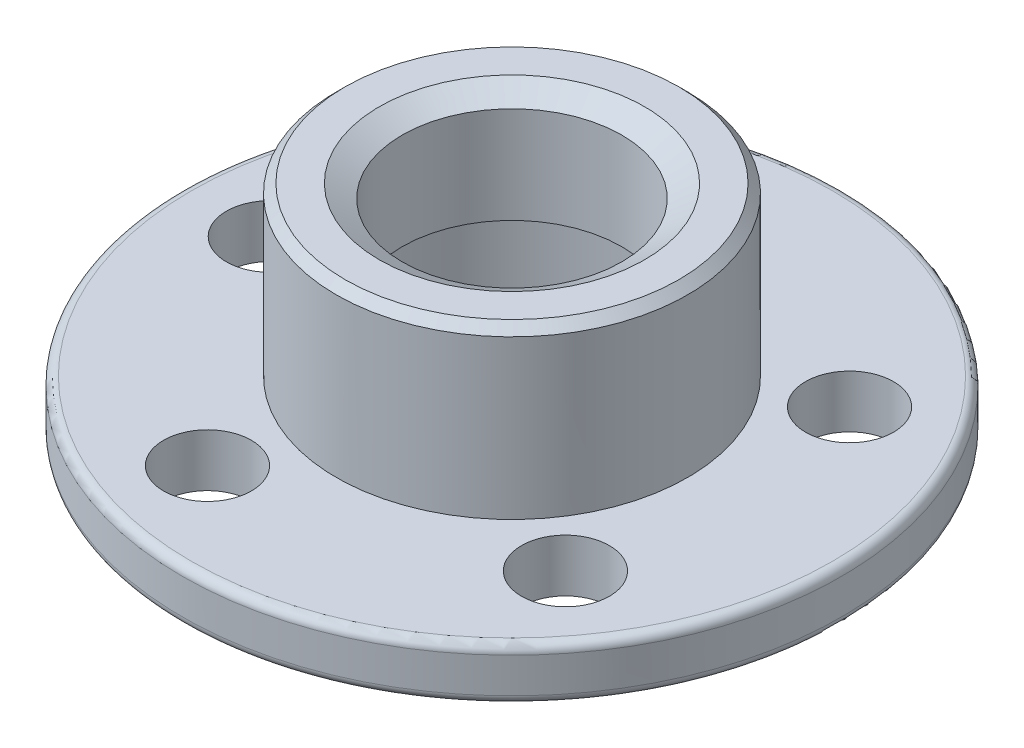
from build123d import *

# Parameters (mm, degrees)
SKETCH_2_W               = 10
SKETCH_2_H               = 12
PATTERN_CIRCULAR_1_COUNT = 5
FILLET_1_R               = 2
CHAMFER_1_SIZE           = 2


with BuildPart() as part:
    # Эскиз1 → Повернуть1 (revolve)
    with BuildSketch(Plane.XY, mode=Mode.PRIVATE) as revolve_1_sk:
        Polygon((35, 0), (75, 0), (75, 12), (40, 12), (40, 50), (25, 50), (25, 25), (35, 25), align=None)
    revolve(revolve_1_sk.sketch.rotate(Axis((0, 0, 0), (0, 1, 0)), 90), axis=Axis((0, 0, 0), (0, 1, 0)))

    # Эскиз2 → Вырез-Повернуть1 (revolve, cut)
    with BuildSketch(Plane.XY, mode=Mode.PRIVATE) as cut_revolve_1_sk:
        with Locations((-60, 6)):
            Rectangle(SKETCH_2_W, SKETCH_2_H)
    cut_revolve_1 = revolve(cut_revolve_1_sk.sketch.rotate(Axis((-55, -2.976144308, 0), (0, 1, 0)), 270), axis=Axis((-55, -2.976144308, 0), (0, 1, 0)), mode=Mode.SUBTRACT)

    # Круговой массив1: Вырез-Повернуть1 ×5 about axis
    pattern_circular_1_axis = Axis((0, 0, 0), (0, 1, 0))
    for i in range(1, PATTERN_CIRCULAR_1_COUNT):
        add(cut_revolve_1.rotate(pattern_circular_1_axis, i * 360 / PATTERN_CIRCULAR_1_COUNT), mode=Mode.SUBTRACT)

    # Скругление1
    fillet_1_edges = [part.edges().sort_by_distance(p)[0] for p in [
        (0, 12, 75),
        (0, 0, 75),
    ]]
    fillet(fillet_1_edges, radius=FILLET_1_R)

    # Фаска1
    chamfer_1_edges = [part.edges().sort_by_distance(p)[0] for p in [
        (0, 50, 40),
    ]]
    chamfer(chamfer_1_edges, length=CHAMFER_1_SIZE)

    # Фаска2: read off the stored shape, not the designer's step
    # Фаска2 outline → Фаска2 (revolve, cut)
    with BuildSketch(Plane.XY):
        Polygon((25, 50), (25, 47), (30.196152423, 50), align=None)
    revolve(axis=Axis((0, 0, 0), (0, 1, 0)), mode=Mode.SUBTRACT)


solid = part.part
